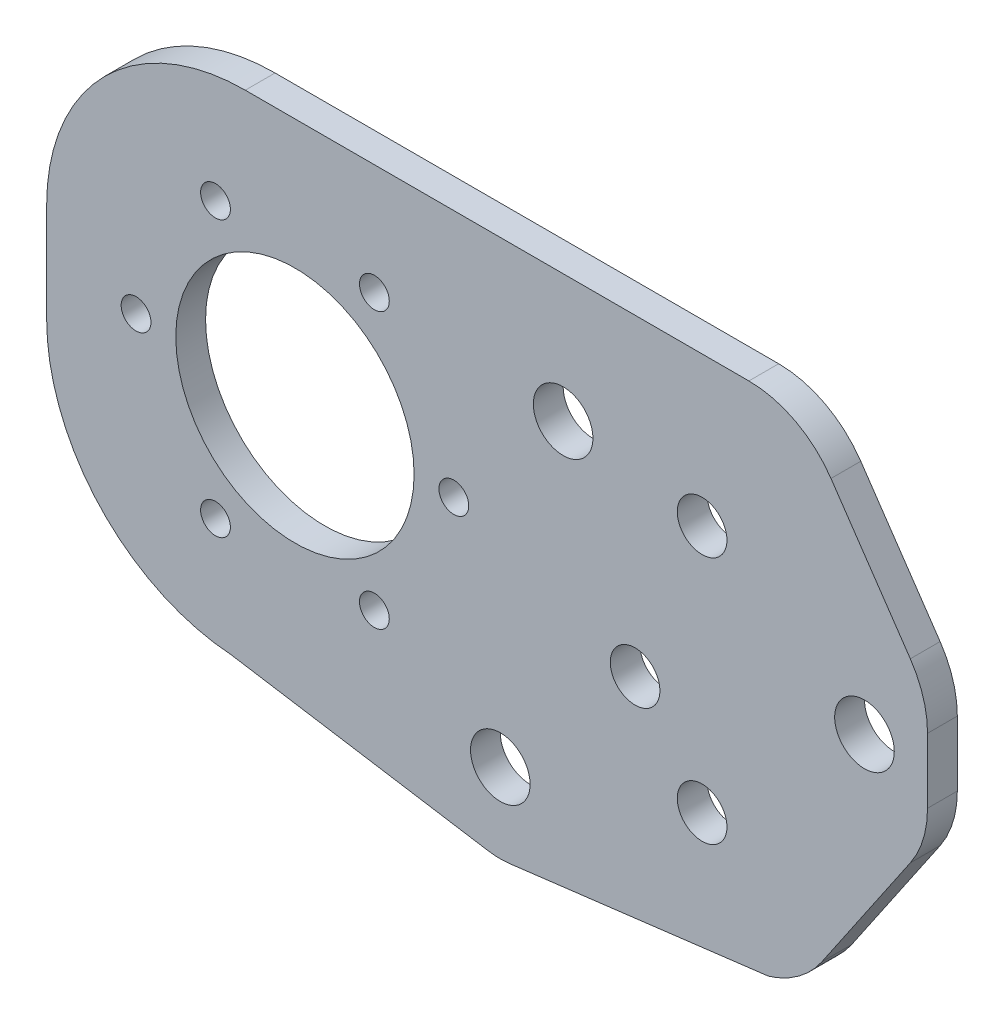
from build123d import *

# Parameters (mm, degrees)
ESBO_O1_W                = 76
ESBO_O1_H                = 50
ESBO_O1_R                = 2.5
ESBO_O1_R_2              = 12
ESBO_O1_R_3              = 1.5
RESSALTO_EXTRUS_O1_DEPTH = 3
ESBO_O2_R                = 2.5
CORTE_EXTRUS_O1_DEPTH    = 3
FILETE1_R                = 20
ESBO_O3_R                = 2.5
RESSALTO_EXTRUS_O2_DEPTH = 3
ESBO_O5_R                = 3
CORTE_EXTRUS_O2_DEPTH    = 92.021975369
RESSALTO_EXTRUS_O3_DEPTH = 3
RESSALTO_EXTRUS_O4_DEPTH = 3
FILETE2_R                = 10
ESBO_O7_R                = 2.5
CORTE_EXTRUS_O3_DEPTH    = 10


with BuildPart() as part:
    # Esboço1 → Ressalto-extrusão1 (new body)
    with BuildSketch(Plane.XY):
        with Locations((38, 25)):
            Rectangle(ESBO_O1_W, ESBO_O1_H)
        with Locations((59.25, 18.5)):
            Circle(ESBO_O1_R, mode=Mode.SUBTRACT)
        with Locations((25, 25)):
            Circle(ESBO_O1_R_2, mode=Mode.SUBTRACT)
        with Locations((17, 38.856406461)):
            Circle(ESBO_O1_R_3, mode=Mode.SUBTRACT)
        with Locations((33, 38.856406461)):
            Circle(ESBO_O1_R_3, mode=Mode.SUBTRACT)
        with Locations((41, 25)):
            Circle(ESBO_O1_R_3, mode=Mode.SUBTRACT)
        with Locations((33, 11.143593539)):
            Circle(ESBO_O1_R_3, mode=Mode.SUBTRACT)
        with Locations((17, 11.143593539)):
            Circle(ESBO_O1_R_3, mode=Mode.SUBTRACT)
        with Locations((9, 25)):
            Circle(ESBO_O1_R_3, mode=Mode.SUBTRACT)
    extrude(amount=RESSALTO_EXTRUS_O1_DEPTH)

    # Esboço2 → Corte-extrusão1 (cut)
    with BuildSketch(Plane.XY.offset(3)):
        with Locations((66, 35)):
            Circle(ESBO_O2_R)
        with Locations((66, 15)):
            Circle(ESBO_O2_R)
    extrude(amount=-CORTE_EXTRUS_O1_DEPTH, mode=Mode.SUBTRACT)

    # Filete1
    filete1_edges = [part.edges().sort_by_distance(p)[0] for p in [
        (0, 50, 1.5),
        (0, 0, 1.5),
    ]]
    fillet(filete1_edges, radius=FILETE1_R)

    # Esboço3 → Ressalto-extrusão2 (add, through all)
    with BuildSketch(Plane.XY.offset(3)):
        with Locations((66, 15)):
            Circle(ESBO_O3_R)
        with Locations((66, 35)):
            Circle(ESBO_O3_R)
    extrude(amount=-RESSALTO_EXTRUS_O2_DEPTH)

    # Esboço5 → Corte-extrusão2 (cut, through all)
    with BuildSketch(Plane(origin=(0, 0, 0), x_dir=(-1, 0, 0), z_dir=(0, 0, -1))):
        with Locations((-45.680731562, 3.807316308)):
            Circle(ESBO_O5_R)
        with Locations((-52.0071049, 37.142437356)):
            Circle(ESBO_O5_R)
    extrude(amount=-CORTE_EXTRUS_O2_DEPTH, mode=Mode.SUBTRACT)

    # Esboço4 → Ressalto-extrusão3 (add, through all)
    with BuildSketch(Plane(origin=(0, 0, 0), x_dir=(-1, 0, 0), z_dir=(0, 0, -1))):
        with BuildLine():
            ThreePointArc((-18.605557994, 0.048670934), (-19.30235443, 0.012171437), (-20, 0))
            Line((-20, 0), (-74.805369877, 0))
            ThreePointArc((-74.805369877, 0), (-73.762195737, -0.525177263), (-72.66490464, -0.925146879))
            Line((-72.66490464, -0.925146879), (-46.660572258, -4.133783454))
            ThreePointArc((-46.660572258, -4.133783454), (-45.535290053, -4.192683692), (-44.412892385, -4.09292021))
            Line((-44.412892385, -4.09292021), (-18.605557994, 0.048670934))
        make_face()
    extrude(amount=-RESSALTO_EXTRUS_O3_DEPTH)

    # Esboço6 → Ressalto-extrusão4 (add, through all)
    with BuildSketch(Plane.XY.offset(3)):
        with BuildLine():
            Line((88.7, 31.35), (76, 50))
            Line((76, 50), (76, 25))
            Line((76, 25), (79.35, 25))
            ThreePointArc((79.35, 25), (82.35, 28), (85.35, 25))
            Line((85.35, 25), (88.7, 25))
            Line((88.7, 25), (88.7, 31.35))
        make_face()
        with BuildLine():
            Line((79.35, 25), (76, 25))
            Line((76, 25), (76, 0))
            Line((76, 0), (88.7, 18.65))
            Line((88.7, 18.65), (88.7, 25))
            Line((88.7, 25), (85.35, 25))
            ThreePointArc((85.35, 25), (82.35, 22), (79.35, 25))
        make_face()
    extrude(amount=-RESSALTO_EXTRUS_O4_DEPTH)

    # Filete2
    # the kernel refuses this fillet: 10 mm, written as the material it takes off along each edge
    with BuildSketch(Plane(origin=(88.7, 18.65, 10.703782372), x_dir=(-0.5628554049483921, -0.8265553781328759, 0), z_dir=(0, 0, -1)), Plane(origin=(88.7, 31.35, 10.703782372), x_dir=(0, -1, 0), z_dir=(0, 0, -1))) as filete2_piece_1:
        with BuildLine():
            CenterArc((FILETE2_R * 0.308151294884, FILETE2_R), FILETE2_R, 235.746501053, 34.253498947)
            Line((-FILETE2_R * 0.254704110065, FILETE2_R * 0.173444621867), (-FILETE2_R * 0.265961218164, FILETE2_R * 0.156913514304))
            Line((-FILETE2_R * 0.265961218164, FILETE2_R * 0.156913514304), (-FILETE2_R * 0.00616302589767, -FILETE2_R * 0.02))
            Line((-FILETE2_R * 0.00616302589767, -FILETE2_R * 0.02), (FILETE2_R * 0.308151294884, -FILETE2_R * 0.02))
            Line((FILETE2_R * 0.308151294884, -FILETE2_R * 0.02), (FILETE2_R * 0.308151294884, 0))
        make_face()
    extrude(amount=18.407564744, mode=Mode.SUBTRACT)
    with BuildSketch(Plane(origin=(76, 50, -13.221878613), x_dir=(-1, 0, 0), z_dir=(0, 0, 1))) as filete2_piece_2:
        with BuildLine():
            CenterArc((FILETE2_R * 0.528875144505, FILETE2_R), FILETE2_R, 214.253498947, 55.746501053)
            Line((-FILETE2_R * 0.297680233628, FILETE2_R * 0.437144595052), (-FILETE2_R * 0.31421134119, FILETE2_R * 0.425887486953))
            Line((-FILETE2_R * 0.31421134119, FILETE2_R * 0.425887486953), (-FILETE2_R * 0.0105775028901, -FILETE2_R * 0.02))
            Line((-FILETE2_R * 0.0105775028901, -FILETE2_R * 0.02), (FILETE2_R * 0.528875144505, -FILETE2_R * 0.02))
            Line((FILETE2_R * 0.528875144505, -FILETE2_R * 0.02), (FILETE2_R * 0.528875144505, 0))
        make_face()
    extrude(amount=29.443757225, mode=Mode.SUBTRACT)
    with BuildSketch(Plane(origin=(76, 0, -9.151102244), x_dir=(-1, 0, 0), z_dir=(0, 0, 1))) as filete2_piece_3:
        with BuildLine():
            CenterArc((6.205254838, -8.65411116), FILETE2_R, 120.070317479, 25.676183574)
            Line((-2.060298944, -3.02555711), (-2.225610019, -2.912986029))
            Line((-2.225610019, -2.912986029), (-0.165311076, 0.112571081))
            Line((-0.165311076, 0.112571081), (0, 0.2))
            ThreePointArc((0, 0.2), (0.597315061, 0.2), (1.094417628, 0.173082223))
            Line((1.094417628, 0.173082223), (1.194630123, 0))
        make_face()
    extrude(amount=21.302204488, mode=Mode.SUBTRACT)

    # Esboço7 → Corte-extrusão3 (cut)
    with BuildSketch(Plane.XY.offset(3)):
        with Locations((66, 35)):
            Circle(ESBO_O7_R)
        with Locations((66, 10)):
            Circle(ESBO_O7_R)
    extrude(amount=-CORTE_EXTRUS_O3_DEPTH, mode=Mode.SUBTRACT)


solid = part.part
